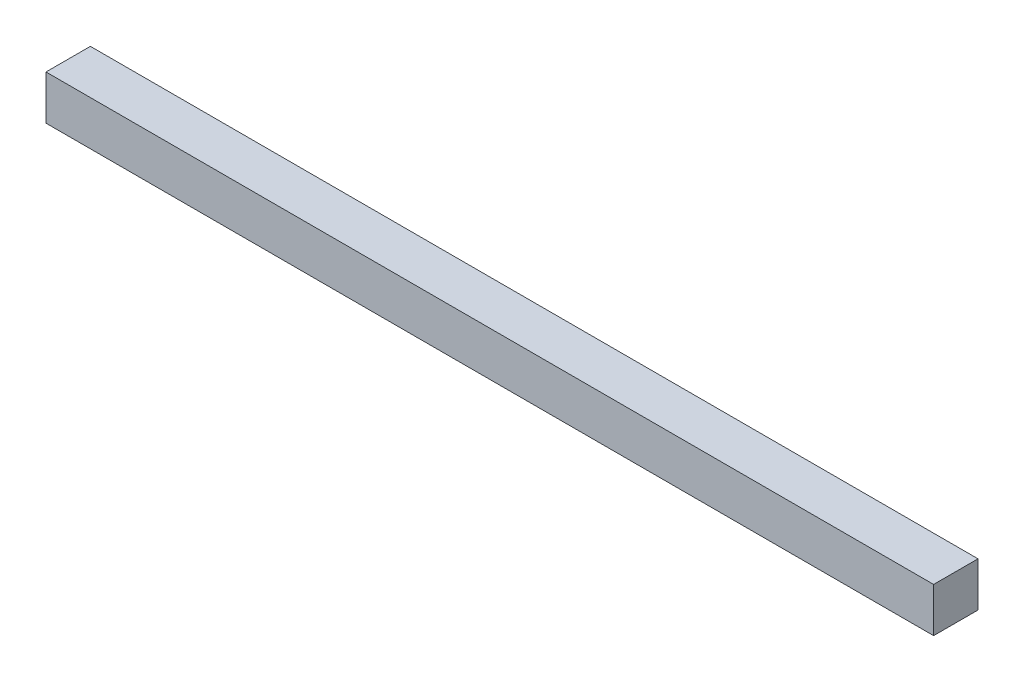
from build123d import *

# Parameters (mm, degrees)
SKETCH1_W           = 200
SKETCH1_H           = 10
BOSS_EXTRUDE1_DEPTH = 5


with BuildPart() as part:
    # Sketch1 → Boss-Extrude1 (new, symmetric)
    with BuildSketch(Plane.XY):
        Rectangle(SKETCH1_W, SKETCH1_H)
    extrude(amount=BOSS_EXTRUDE1_DEPTH, both=True)


solid = part.part
